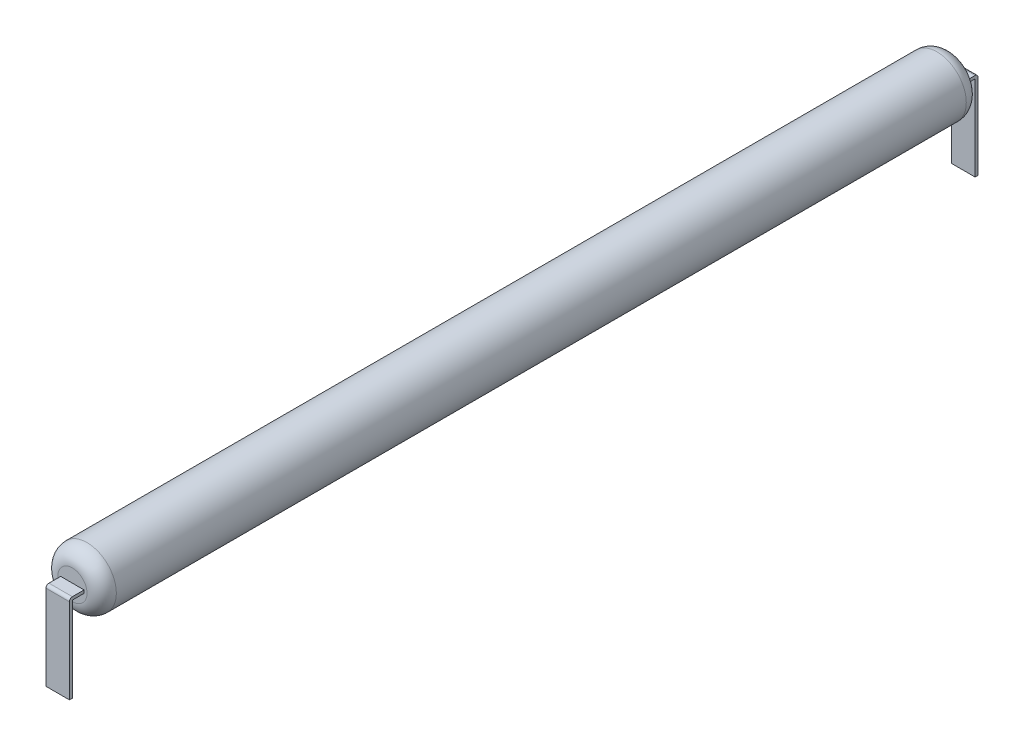
from build123d import *

# Parameters (mm, degrees)
BOSS_EXTRU_1_DEPTH      = 15
BOSS_EXTRU_1_DEPTH_BACK = 15
ESQUISSE1_R             = 1
ESQUISSE2_W             = 0.8
ESQUISSE2_H             = 0.1
BOSS_EXTRU_2_DEPTH      = 1
ESQUISSE3_W             = 0.8
ESQUISSE3_H             = 0.1
BOSS_EXTRU_3_DEPTH      = 1
CONG_1_R                = 0.5
ESQUISSE4_W             = 0.1
ESQUISSE4_H             = 3
BOSS_EXTRU_4_DEPTH      = 0.8
ESQUISSE5_W             = 0.5
ESQUISSE5_H             = 0.1
ENL_V_MAT_EXTRU_1_DEPTH = 0.8
CONG_2_R                = 0.1
ESQUISSE6_W             = 0.1
ESQUISSE6_H             = 3
BOSS_EXTRU_5_DEPTH      = 0.8
ESQUISSE7_W             = 0.5
ESQUISSE7_H             = 0.1
ENL_V_MAT_EXTRU_2_DEPTH = 0.8
CONG_3_R                = 0.1


with BuildPart() as part:
    # Esquisse1 → Boss.-Extru.1 (new, two sides: drawn at the far end of the back side and taken through both)
    with BuildSketch(Plane.XY.offset(-BOSS_EXTRU_1_DEPTH_BACK)):
        Circle(ESQUISSE1_R)
    extrude(amount=BOSS_EXTRU_1_DEPTH + BOSS_EXTRU_1_DEPTH_BACK)

    # Esquisse2 → Boss.-Extru.2 (add)
    with BuildSketch(Plane.XY.offset(15)):
        Rectangle(ESQUISSE2_W, ESQUISSE2_H)
    extrude(amount=BOSS_EXTRU_2_DEPTH)

    # Esquisse3 → Boss.-Extru.3 (add)
    with BuildSketch(Plane(origin=(0, 0, -15), x_dir=(-1, 0, 0), z_dir=(0, 0, -1))):
        Rectangle(ESQUISSE3_W, ESQUISSE3_H)
    extrude(amount=BOSS_EXTRU_3_DEPTH)

    # Congé1
    cong_1_edges = [part.edges().sort_by_distance(p)[0] for p in [
        (-1, 0, 15),
        (-1, 0, -15),
    ]]
    fillet(cong_1_edges, radius=CONG_1_R)

    # Esquisse4 → Boss.-Extru.4 (add)
    with BuildSketch(Plane.ZY.offset(0.4)):
        with Locations((-15.45, -1.45)):
            Rectangle(ESQUISSE4_W, ESQUISSE4_H)
    extrude(amount=-BOSS_EXTRU_4_DEPTH)

    # Esquisse5 → Enlèv. mat.-Extru.1 (cut)
    with BuildSketch(Plane.ZY.offset(0.4)):
        with Locations((-15.75, 0)):
            Rectangle(ESQUISSE5_W, ESQUISSE5_H)
    extrude(amount=-ENL_V_MAT_EXTRU_1_DEPTH, mode=Mode.SUBTRACT)

    # Congé2
    cong_2_edges = [part.edges().sort_by_distance(p)[0] for p in [
        (0, 0.05, -15.5),
    ]]
    fillet(cong_2_edges, radius=CONG_2_R - 0.0001)  # a hair under: the kernel refuses the full size

    # Esquisse6 → Boss.-Extru.5 (add)
    with BuildSketch(Plane.ZY.offset(0.4)):
        with Locations((15.45, -1.45)):
            Rectangle(ESQUISSE6_W, ESQUISSE6_H)
    extrude(amount=-BOSS_EXTRU_5_DEPTH)

    # Esquisse7 → Enlèv. mat.-Extru.2 (cut)
    with BuildSketch(Plane.ZY.offset(0.4)):
        with Locations((15.75, 0)):
            Rectangle(ESQUISSE7_W, ESQUISSE7_H)
    extrude(amount=-ENL_V_MAT_EXTRU_2_DEPTH, mode=Mode.SUBTRACT)

    # Congé3
    cong_3_edges = [part.edges().sort_by_distance(p)[0] for p in [
        (0, 0.05, 15.5),
    ]]
    fillet(cong_3_edges, radius=CONG_3_R)


solid = part.part
